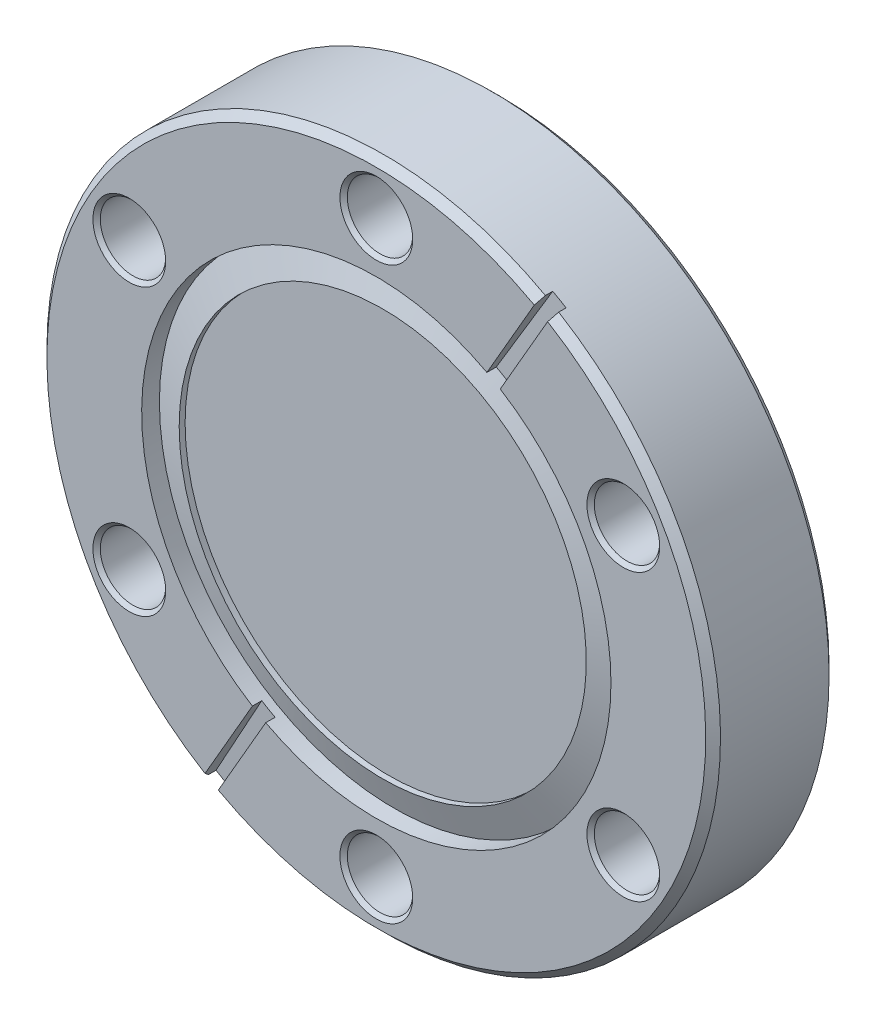
from build123d import *
from build123d.topology import SkipClean

# Parameters (mm, degrees)
CUT_EXTRUDE1_START       = -11.734260502
CUT_EXTRUDE1_OUTLINE_R   = 34.671
CUT_EXTRUDE1_DEPTH       = 11.182953842
CUT_EXTRUDE1_START_2     = -0.55130666
CUT_EXTRUDE1_2_OUTLINE_R = 24.1554
CUT_EXTRUDE1_2_DEPTH     = 0.856646158
CUT_EXTRUDE1_3_DEPTH     = 0.55130666
CUT_EXTRUDE1_START_3     = -0.79375
CUT_EXTRUDE1_5_DEPTH     = 1.5875
CUT_EXTRUDE2_START       = -0.55130666
CUT_EXTRUDE2_DEPTH       = 0.55130666
BOSS_EXTRUDE1_DEPTH      = 0.55130666
BOSS_EXTRUDE2_DEPTH      = 0.55130666
BOSS_EXTRUDE3_DEPTH      = 0.965739498
BOSS_EXTRUDE4_DEPTH      = 0.965739498
SKETCH7_R                = 20.955
CUT_EXTRUDE3_DEPTH       = 0.6096
M6_CLEARANCE_HOLE1_D     = 6.731
M6_CLEARANCE_HOLE2_D     = 6.731
CHAMFER1_SIZE            = 0.381
CHAMFER2_SIZE            = 0.762


with BuildPart() as part:
    # Cut-Extrude1: read off the stored shape, not the designer's step
    # Cut-Extrude1 outline → Cut-Extrude1 (new body)
    with BuildSketch(Plane.XY.offset(-0.965739498).offset(CUT_EXTRUDE1_START)):
        Circle(CUT_EXTRUDE1_OUTLINE_R)
    extrude(amount=CUT_EXTRUDE1_DEPTH)

    # Cut-Extrude1 2 outline → Cut-Extrude1 2 (add)
    with BuildSketch(Plane.XY.offset(-0.965739498).offset(CUT_EXTRUDE1_START_2)):
        Circle(CUT_EXTRUDE1_2_OUTLINE_R)
    extrude(amount=CUT_EXTRUDE1_2_DEPTH)

    # Cut-Extrude1 3 outline → Cut-Extrude1 3 (add)
    with BuildSketch(Plane.XY.offset(-0.965739498).offset(CUT_EXTRUDE1_START_2)):
        with BuildLine():
            Line((12.758585218, 20.51101783), (18.018364086, 29.621222066))
            ThreePointArc((18.018364086, 29.621222066), (-30.025966775, 17.3355), (-16.643548757, -30.414972066))
            Line((-16.643548757, -30.414972066), (-11.383769889, -21.30476783))
            ThreePointArc((-11.383769889, -21.30476783), (-20.919190039, 12.0777), (12.758585218, 20.51101783))
        make_face()
    extrude(amount=CUT_EXTRUDE1_3_DEPTH)

    # Cut-Extrude1 4 outline → Cut-Extrude1 4 (revolve, cut)
    with BuildSketch(Plane.XZ):
        Polygon((24.1554, -1.825250338), (24.1554, -0.6604), (20.955, -0.6604), align=None)
    revolve(axis=Axis((0, 0, 0), (0, 0, 1)), mode=Mode.SUBTRACT)

    # Cut-Extrude1 5 outline → Cut-Extrude1 5 (cut)
    with BuildSketch(Plane(origin=(0, 0, 0), x_dir=(0.49999999999977696, 0.8660254037845674, 0), z_dir=(0.8660254037845674, -0.4999999999997772, 0)).offset(CUT_EXTRUDE1_START_3)):
        Polygon((36, -0.965739498), (24.142355107, -0.965739498), (34.671, -1.517522396), (36, -1.587172335), align=None)
        Polygon((-34.671, -1.517522396), (-24.142355107, -0.965739498), (-36, -0.965739498), (-36, -1.587172335), align=None)
    extrude(amount=CUT_EXTRUDE1_5_DEPTH, mode=Mode.SUBTRACT)

    # Sketch2 → Cut-Extrude2 (cut)
    with BuildSketch(Plane.XY.offset(-0.965739498).offset(CUT_EXTRUDE2_START)):
        with BuildLine():
            Line((-18.018364086, -29.621222066), (-12.758585218, -20.51101783))
            ThreePointArc((-12.758585218, -20.51101783), (-20.919190039, 12.0777), (11.383769889, 21.30476783))
            Line((11.383769889, 21.30476783), (16.643548757, 30.414972066))
            ThreePointArc((16.643548757, 30.414972066), (-30.025966775, 17.3355), (-18.018364086, -29.621222066))
        make_face()
    extrude(amount=CUT_EXTRUDE2_DEPTH, mode=Mode.SUBTRACT)

    # Sketch3 → Boss-Extrude1 (add)
    with SkipClean():  # the faces are left unmerged after this step: merging them gives an invalid solid
        with BuildSketch(Plane.XY.offset(-1.517046158)):
            with BuildLine():
                Line((-16.643548757, -30.414972066), (-11.383769889, -21.30476783))
                ThreePointArc((-11.383769889, -21.30476783), (20.919190039, -12.0777), (12.758585218, 20.51101783))
                Line((12.758585218, 20.51101783), (18.018364086, 29.621222066))
                ThreePointArc((18.018364086, 29.621222066), (30.025966775, -17.3355), (-16.643548757, -30.414972066))
            make_face()
        extrude(amount=BOSS_EXTRUDE1_DEPTH)

    # Sketch4 → Boss-Extrude2 (add)
    with SkipClean():  # the faces are left unmerged after this step: merging them gives an invalid solid
        with BuildSketch(Plane.XY.offset(-1.517046158)):
            with BuildLine():
                Line((16.643548757, 30.414972066), (11.383769889, 21.30476783))
                ThreePointArc((11.383769889, 21.30476783), (-20.919190039, 12.0777), (-12.758585218, -20.51101783))
                Line((-12.758585218, -20.51101783), (-18.018364086, -29.621222066))
                ThreePointArc((-18.018364086, -29.621222066), (-30.025966775, 17.3355), (16.643548757, 30.414972066))
            make_face()
        extrude(amount=BOSS_EXTRUDE2_DEPTH)

    # Sketch5 → Boss-Extrude3 (add)
    with SkipClean():  # the faces are left unmerged after this step: merging them gives an invalid solid
        with BuildSketch(Plane.XY.offset(-0.965739498)):
            with BuildLine():
                Line((-16.643548757, -30.414972066), (-11.383769889, -21.30476783))
                ThreePointArc((-11.383769889, -21.30476783), (20.919190039, -12.0777), (12.758585218, 20.51101783))
                Line((12.758585218, 20.51101783), (18.018364086, 29.621222066))
                ThreePointArc((18.018364086, 29.621222066), (30.025966775, -17.3355), (-16.643548757, -30.414972066))
            make_face()
        extrude(amount=BOSS_EXTRUDE3_DEPTH)

    # Sketch6 → Boss-Extrude4 (add)
    with SkipClean():  # the faces are left unmerged after this step: merging them gives an invalid solid
        with BuildSketch(Plane.XY.offset(-0.965739498)):
            with BuildLine():
                Line((16.643548757, 30.414972066), (11.383769889, 21.30476783))
                ThreePointArc((11.383769889, 21.30476783), (-20.919190039, 12.0777), (-12.758585218, -20.51101783))
                Line((-12.758585218, -20.51101783), (-18.018364086, -29.621222066))
                ThreePointArc((-18.018364086, -29.621222066), (-30.025966775, 17.3355), (16.643548757, 30.414972066))
            make_face()
        extrude(amount=BOSS_EXTRUDE4_DEPTH)

    # Sketch7 → Cut-Extrude3 (cut)
    with SkipClean():  # the faces are left unmerged after this step: merging them gives an invalid solid
        with BuildSketch(Plane.XY.offset(-0.6604)):
            with Locations(Location((0, 0, 0), (0, 0, 180))):
                Circle(SKETCH7_R)
        extrude(amount=-CUT_EXTRUDE3_DEPTH, mode=Mode.SUBTRACT)

    # M6 Clearance Hole1 (through all)
    with Locations(Plane(origin=(0, 0, -12.7), x_dir=(-1, 0, 0), z_dir=(0, 0, -1))):
        with Locations((-25.428584316, 14.6812)):
            Hole(M6_CLEARANCE_HOLE1_D / 2)

    # M6 Clearance Hole2 (through all)
    with Locations(Plane.XY):
        with Locations((0, 29.3624), (25.428584316, -14.6812), (0, -29.3624), (-25.428584316, -14.6812), (-25.428584316, 14.6812)):
            Hole(M6_CLEARANCE_HOLE2_D / 2)

    # Chamfer1
    chamfer1_edges = [part.edges().sort_by_distance(p)[0] for p in [
        (22.063084316, 14.6812, -12.7),
        (22.063084316, 14.6812, 0),
        (-22.063084316, 14.6812, 0),
        (-22.063084316, 14.6812, -12.7),
        (-22.063084316, -14.6812, 0),
        (-22.063084316, -14.6812, -12.7),
        (3.3655, -29.3624, 0),
        (3.3655, -29.3624, -12.7),
        (28.794084316, -14.6812, 0),
        (28.794084316, -14.6812, -12.7),
        (3.3655, 29.3624, 0),
        (3.3655, 29.3624, -12.7),
    ]]
    chamfer(chamfer1_edges, length=CHAMFER1_SIZE)

    # Chamfer2
    chamfer2_edges = [part.edges().sort_by_distance(p)[0] for p in [
        (30.025966775, -17.3355, 0),
        (-30.025966775, 17.3355, 0),
        (-34.671, 0, -12.7),
    ]]
    chamfer(chamfer2_edges, length=CHAMFER2_SIZE)


solid = part.part
